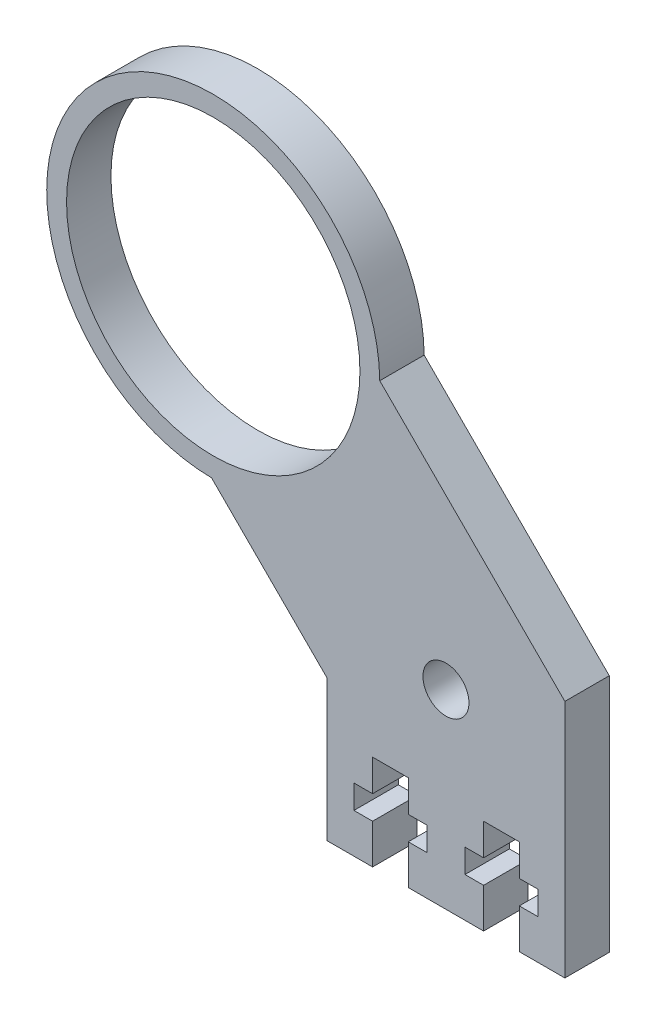
from build123d import *

# Parameters (mm, degrees)
SKETCH1_R           = 2.9
BOSS_EXTRUDE1_DEPTH = 5.6
SKETCH2_R           = 18.5
CUT_EXTRUDE1_DEPTH  = 72.418374661
CUT_EXTRUDE2_DEPTH  = 72.418374661


with BuildPart() as part:
    # Sketch1 → Boss-Extrude1 (new body)
    with BuildSketch(Plane.XY):
        with BuildLine():
            Line((-15, -6.213203436), (-15, -24))
            Line((-15, -24), (15, -24))
            Line((15, -24), (15, 6.213203436))
            Line((15, 6.213203436), (-8.346024856, 29.559228292))
            ThreePointArc((-8.346024856, 29.559228292), (-44.194173824, 44.194173824), (-29.559228292, 8.346024856))
            Line((-29.559228292, 8.346024856), (-15, -6.213203436))
        make_face()
        Circle(SKETCH1_R, mode=Mode.SUBTRACT)
    extrude(amount=BOSS_EXTRUDE1_DEPTH)

    # Sketch2 → Cut-Extrude1 (cut, through all)
    with BuildSketch(Plane.XY.offset(5.6)):
        with Locations((-29.344931419, 29.344931419)):
            Circle(SKETCH2_R)
    extrude(amount=-CUT_EXTRUDE1_DEPTH, mode=Mode.SUBTRACT)

    # Sketch3 → Cut-Extrude2 (cut, through all)
    with BuildSketch(Plane.XY.offset(5.6)):
        Polygon((-9.25, -24), (-4.75, -24), (-4.75, -19), (-2.4, -19), (-2.4, -16), (-4.75, -16), (-4.75, -12), (-9.25, -12), (-9.25, -16), (-11.6, -16), (-11.6, -19), (-9.25, -19), align=None)
        Polygon((4.75, -16), (4.75, -12), (9.25, -12), (9.25, -16), (11.6, -16), (11.6, -19), (9.25, -19), (9.25, -24), (4.75, -24), (4.75, -19), (2.4, -19), (2.4, -16), align=None)
    extrude(amount=-CUT_EXTRUDE2_DEPTH, mode=Mode.SUBTRACT)


solid = part.part
